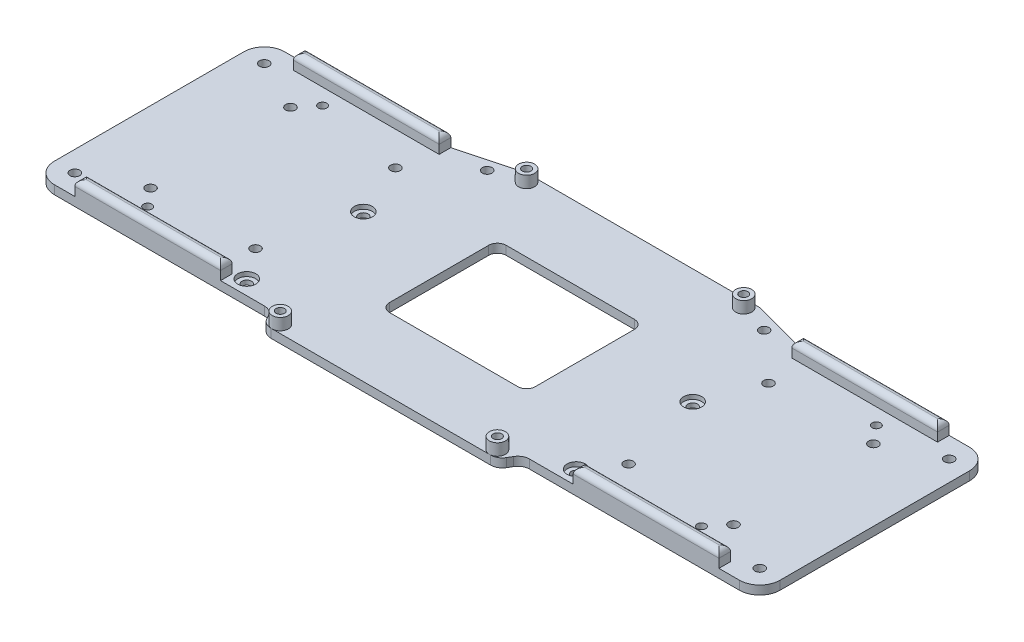
from build123d import *

# Parameters (mm, degrees)
SKETCH_1_R                                 = 1.65
EXTRUDE_1_DEPTH                            = 3
EXTRUDE_5_DEPTH                            = 3
SKETCH_3_R                                 = 2.75
EXTRUDE_3_DEPTH                            = 4
CUT_EXTRUDE_1_REACH                        = 134.568
SKETCH_4_R                                 = 1.45
CUT_EXTRUDE_2_REACH                        = 134.443
SKETCH_5_R                                 = 1.45
CUT_EXTRUDE_3_REACH                        = 134.443
SKETCH_6_R                                 = 1.65
CUT_EXTRUDE_4_REACH                        = 134.443
SKETCH_7_R                                 = 1.65
SKETCH_9_W                                 = 50
SKETCH_9_H                                 = 4
EXTRUDE_4_DEPTH                            = 5
MIRROR_4_AT_THE_SECOND_PLANE_COPY_1_SKET_W = 50
MIRROR_4_AT_THE_SECOND_PLANE_COPY_1_SKET_H = 4
MIRROR_4_AT_THE_SECOND_PLANE_COPY_1_DEPTH  = 5
FILLET_1_R                                 = 2
FILLET_2_R                                 = 4
CUT_EXTRUDE_6_REACH                        = 134.477
SKETCH_12_R                                = 3.1
CUT_EXTRUDE_7_DEPTH                        = 1.5
EXTRUDE_6_DEPTH                            = 3
FILLET_START                               = -1
FILLET_3_DEPTH                             = 5
FILLET_3_2_DEPTH                           = 3
CUT_EXTRUDE_8_REACH                        = 134.477
SKETCH_15_R                                = 1.65


with BuildPart() as part:
    # 草图1 → 凸台-拉伸1 (new body)
    with BuildSketch(Plane(origin=(0, 0, 0), x_dir=(1, 0, 0), z_dir=(0, 1, 0))):
        with BuildLine():
            Line((-124.5, 32.5), (-124.5, -32.5))
            ThreePointArc((-124.5, -32.5), (-122.449747468, -37.449747468), (-117.5, -39.5))
            Line((-117.5, -39.5), (117.5, -39.5))
            ThreePointArc((117.5, -39.5), (122.449747468, -37.449747468), (124.5, -32.5))
            Line((124.5, -32.5), (124.5, 32.5))
            ThreePointArc((124.5, 32.5), (122.449747468, 37.449747468), (117.5, 39.5))
            Line((117.5, 39.5), (-117.5, 39.5))
            ThreePointArc((-117.5, 39.5), (-122.449747468, 37.449747468), (-124.5, 32.5))
        make_face()
        with Locations(Location((-117.5, 32.5, 0), (0, 0, 270))):
            Circle(SKETCH_1_R, mode=Mode.SUBTRACT)
        with Locations(Location((-117.5, -32.5, 0), (0, 0, 270))):
            Circle(SKETCH_1_R, mode=Mode.SUBTRACT)
        with Locations(Location((117.5, 32.5, 0), (0, 0, 270))):
            Circle(SKETCH_1_R, mode=Mode.SUBTRACT)
        with Locations(Location((117.5, -32.5, 0), (0, 0, 270))):
            Circle(SKETCH_1_R, mode=Mode.SUBTRACT)
    extrude(amount=EXTRUDE_1_DEPTH)

    # 草图10 → 凸台-拉伸5 (add)
    with BuildSketch(Plane(origin=(0, 3, 0), x_dir=(1, 0, 0), z_dir=(0, 1, 0))):
        Polygon((-43.175426481, 39.5), (-40, 45), (40, 45), (43.175426481, 39.5), align=None)
        Polygon((-40, -45), (-43.175426481, -39.5), (43.175426481, -39.5), (40, -45), align=None)
    extrude(amount=-EXTRUDE_5_DEPTH)

    # 草图3 → 凸台-拉伸3 (add)
    with BuildSketch(Plane(origin=(0, 3, 0), x_dir=(1, 0, 0), z_dir=(0, 1, 0))):
        with Locations(Location((-37.25, 42.25, 0), (0, 0, 90))):
            Circle(SKETCH_3_R)
        with Locations(Location((37.25, 42.25, 0), (0, 0, 90))):
            Circle(SKETCH_3_R)
        with Locations(Location((-37.25, -42.25, 0), (0, 0, 270))):
            Circle(SKETCH_3_R)
        with Locations(Location((37.25, -42.25, 0), (0, 0, 270))):
            Circle(SKETCH_3_R)
    extrude(amount=EXTRUDE_3_DEPTH)

    # 草图4 → 切除-拉伸1 (cut, up to next)
    with BuildSketch(Plane(origin=(0, 7, 0), x_dir=(1, 0, 0), z_dir=(0, 1, 0)), mode=Mode.PRIVATE) as cut_extrude_1_sk1:
        with Locations(Location((-37.25, 42.25, 0), (0, 0, 270))):
            Circle(SKETCH_4_R)
    cut_extrude_1_tool1 = extrude(cut_extrude_1_sk1.sketch, amount=-CUT_EXTRUDE_1_REACH, mode=Mode.PRIVATE) & part.part
    # 草图4 → 切除-拉伸1 (cut, up to next)
    with BuildSketch(Plane(origin=(0, 7, 0), x_dir=(1, 0, 0), z_dir=(0, 1, 0)), mode=Mode.PRIVATE) as cut_extrude_1_sk2:
        with Locations(Location((37.25, 42.25, 0), (0, 0, 270))):
            Circle(SKETCH_4_R)
    cut_extrude_1_tool2 = extrude(cut_extrude_1_sk2.sketch, amount=-CUT_EXTRUDE_1_REACH, mode=Mode.PRIVATE) & part.part
    # 草图4 → 切除-拉伸1 (cut, up to next)
    with BuildSketch(Plane(origin=(0, 7, 0), x_dir=(1, 0, 0), z_dir=(0, 1, 0)), mode=Mode.PRIVATE) as cut_extrude_1_sk3:
        with Locations(Location((-37.25, -42.25, 0), (0, 0, 270))):
            Circle(SKETCH_4_R)
    cut_extrude_1_tool3 = extrude(cut_extrude_1_sk3.sketch, amount=-CUT_EXTRUDE_1_REACH, mode=Mode.PRIVATE) & part.part
    # 草图4 → 切除-拉伸1 (cut, up to next)
    with BuildSketch(Plane(origin=(0, 7, 0), x_dir=(1, 0, 0), z_dir=(0, 1, 0)), mode=Mode.PRIVATE) as cut_extrude_1_sk4:
        with Locations(Location((37.25, -42.25, 0), (0, 0, 270))):
            Circle(SKETCH_4_R)
    cut_extrude_1_tool4 = extrude(cut_extrude_1_sk4.sketch, amount=-CUT_EXTRUDE_1_REACH, mode=Mode.PRIVATE) & part.part
    add(cut_extrude_1_tool1.solids().sort_by_distance((-37.25, 7, -42.25))[0], mode=Mode.SUBTRACT)
    add(cut_extrude_1_tool2.solids().sort_by_distance((37.25, 7, -42.25))[0], mode=Mode.SUBTRACT)
    add(cut_extrude_1_tool3.solids().sort_by_distance((-37.25, 7, 42.25))[0], mode=Mode.SUBTRACT)
    add(cut_extrude_1_tool4.solids().sort_by_distance((37.25, 7, 42.25))[0], mode=Mode.SUBTRACT)

    # 草图5 → 切除-拉伸2 (cut, up to next)
    with BuildSketch(Plane(origin=(0, 3, 0), x_dir=(1, 0, 0), z_dir=(0, 1, 0)), mode=Mode.PRIVATE) as cut_extrude_2_sk1:
        with Locations(Location((-95, 30, 0), (0, 0, 270))):
            Circle(SKETCH_5_R)
    cut_extrude_2_tool1 = extrude(cut_extrude_2_sk1.sketch, amount=-CUT_EXTRUDE_2_REACH, mode=Mode.PRIVATE) & part.part
    # 草图5 → 切除-拉伸2 (cut, up to next)
    with BuildSketch(Plane(origin=(0, 3, 0), x_dir=(1, 0, 0), z_dir=(0, 1, 0)), mode=Mode.PRIVATE) as cut_extrude_2_sk2:
        with Locations(Location((-95, -30, 0), (0, 0, 270))):
            Circle(SKETCH_5_R)
    cut_extrude_2_tool2 = extrude(cut_extrude_2_sk2.sketch, amount=-CUT_EXTRUDE_2_REACH, mode=Mode.PRIVATE) & part.part
    # 草图5 → 切除-拉伸2 (cut, up to next)
    with BuildSketch(Plane(origin=(0, 3, 0), x_dir=(1, 0, 0), z_dir=(0, 1, 0)), mode=Mode.PRIVATE) as cut_extrude_2_sk3:
        with Locations(Location((95, 30, 0), (0, 0, 270))):
            Circle(SKETCH_5_R)
    cut_extrude_2_tool3 = extrude(cut_extrude_2_sk3.sketch, amount=-CUT_EXTRUDE_2_REACH, mode=Mode.PRIVATE) & part.part
    # 草图5 → 切除-拉伸2 (cut, up to next)
    with BuildSketch(Plane(origin=(0, 3, 0), x_dir=(1, 0, 0), z_dir=(0, 1, 0)), mode=Mode.PRIVATE) as cut_extrude_2_sk4:
        with Locations(Location((95, -30, 0), (0, 0, 270))):
            Circle(SKETCH_5_R)
    cut_extrude_2_tool4 = extrude(cut_extrude_2_sk4.sketch, amount=-CUT_EXTRUDE_2_REACH, mode=Mode.PRIVATE) & part.part
    add(cut_extrude_2_tool1.solids().sort_by_distance((-95, 3, -30))[0], mode=Mode.SUBTRACT)
    add(cut_extrude_2_tool2.solids().sort_by_distance((-95, 3, 30))[0], mode=Mode.SUBTRACT)
    add(cut_extrude_2_tool3.solids().sort_by_distance((95, 3, -30))[0], mode=Mode.SUBTRACT)
    add(cut_extrude_2_tool4.solids().sort_by_distance((95, 3, 30))[0], mode=Mode.SUBTRACT)

    # 草图6 → 切除-拉伸3 (cut, up to next)
    with BuildSketch(Plane(origin=(0, 3, 0), x_dir=(1, 0, 0), z_dir=(0, 1, 0)), mode=Mode.PRIVATE) as cut_extrude_3_sk1:
        with Locations(Location((-56.5, 5.5, 0), (0, 0, 270))):
            Circle(SKETCH_6_R)
    cut_extrude_3_tool1 = extrude(cut_extrude_3_sk1.sketch, amount=-CUT_EXTRUDE_3_REACH, mode=Mode.PRIVATE) & part.part
    # 草图6 → 切除-拉伸3 (cut, up to next)
    with BuildSketch(Plane(origin=(0, 3, 0), x_dir=(1, 0, 0), z_dir=(0, 1, 0)), mode=Mode.PRIVATE) as cut_extrude_3_sk2:
        with Locations(Location((-56.5, -34.5, 0), (0, 0, 270))):
            Circle(SKETCH_6_R)
    cut_extrude_3_tool2 = extrude(cut_extrude_3_sk2.sketch, amount=-CUT_EXTRUDE_3_REACH, mode=Mode.PRIVATE) & part.part
    cut_extrude_3_1 = cut_extrude_3_tool1.solids().sort_by_distance((-56.5, 3, -5.5))[0]
    add(cut_extrude_3_1, mode=Mode.SUBTRACT)
    cut_extrude_3_2 = cut_extrude_3_tool2.solids().sort_by_distance((-56.5, 3, 34.5))[0]
    add(cut_extrude_3_2, mode=Mode.SUBTRACT)
    cut_extrude_3 = cut_extrude_3_1 + cut_extrude_3_2  # 切除-拉伸3 as one shape, for the pattern or mirror that repeats it

    # 草图7 → 切除-拉伸4 (cut, up to next)
    with BuildSketch(Plane(origin=(0, 3, 0), x_dir=(1, 0, 0), z_dir=(0, 1, 0)), mode=Mode.PRIVATE) as cut_extrude_4_sk1:
        with Locations(Location((-100, 24, 0), (0, 0, 270))):
            Circle(SKETCH_7_R)
    cut_extrude_4_tool1 = extrude(cut_extrude_4_sk1.sketch, amount=-CUT_EXTRUDE_4_REACH, mode=Mode.PRIVATE) & part.part
    # 草图7 → 切除-拉伸4 (cut, up to next)
    with BuildSketch(Plane(origin=(0, 3, 0), x_dir=(1, 0, 0), z_dir=(0, 1, 0)), mode=Mode.PRIVATE) as cut_extrude_4_sk2:
        with Locations(Location((-64, 24, 0), (0, 0, 270))):
            Circle(SKETCH_7_R)
    cut_extrude_4_tool2 = extrude(cut_extrude_4_sk2.sketch, amount=-CUT_EXTRUDE_4_REACH, mode=Mode.PRIVATE) & part.part
    # 草图7 → 切除-拉伸4 (cut, up to next)
    with BuildSketch(Plane(origin=(0, 3, 0), x_dir=(1, 0, 0), z_dir=(0, 1, 0)), mode=Mode.PRIVATE) as cut_extrude_4_sk3:
        with Locations(Location((-100, -24, 0), (0, 0, 270))):
            Circle(SKETCH_7_R)
    cut_extrude_4_tool3 = extrude(cut_extrude_4_sk3.sketch, amount=-CUT_EXTRUDE_4_REACH, mode=Mode.PRIVATE) & part.part
    # 草图7 → 切除-拉伸4 (cut, up to next)
    with BuildSketch(Plane(origin=(0, 3, 0), x_dir=(1, 0, 0), z_dir=(0, 1, 0)), mode=Mode.PRIVATE) as cut_extrude_4_sk4:
        with Locations(Location((-64, -24, 0), (0, 0, 270))):
            Circle(SKETCH_7_R)
    cut_extrude_4_tool4 = extrude(cut_extrude_4_sk4.sketch, amount=-CUT_EXTRUDE_4_REACH, mode=Mode.PRIVATE) & part.part
    cut_extrude_4_1 = cut_extrude_4_tool1.solids().sort_by_distance((-100, 3, -24))[0]
    add(cut_extrude_4_1, mode=Mode.SUBTRACT)
    cut_extrude_4_2 = cut_extrude_4_tool2.solids().sort_by_distance((-64, 3, -24))[0]
    add(cut_extrude_4_2, mode=Mode.SUBTRACT)
    cut_extrude_4_3 = cut_extrude_4_tool3.solids().sort_by_distance((-100, 3, 24))[0]
    add(cut_extrude_4_3, mode=Mode.SUBTRACT)
    cut_extrude_4_4 = cut_extrude_4_tool4.solids().sort_by_distance((-64, 3, 24))[0]
    add(cut_extrude_4_4, mode=Mode.SUBTRACT)
    cut_extrude_4 = cut_extrude_4_1 + cut_extrude_4_2 + cut_extrude_4_3 + cut_extrude_4_4  # 切除-拉伸4 as one shape, for the pattern or mirror that repeats it

    # 草图9 → 凸台-拉伸4 (add)
    with BuildSketch(Plane(origin=(0, 3, 0), x_dir=(1, 0, 0), z_dir=(0, 1, 0))):
        with Locations((-85.5, -37.5)):
            Rectangle(SKETCH_9_W, SKETCH_9_H)
    extrude_4 = extrude(amount=EXTRUDE_4_DEPTH)

    # 镜向1: 切除-拉伸3, 切除-拉伸4 across plane
    add(cut_extrude_3.mirror(Plane(origin=(0, 0, 0), x_dir=(0, 0, 1), z_dir=(1, 0, 0))), mode=Mode.SUBTRACT)
    add(cut_extrude_4.mirror(Plane(origin=(0, 0, 0), x_dir=(0, 0, 1), z_dir=(1, 0, 0))), mode=Mode.SUBTRACT)

    # 镜向4: 凸台-拉伸4 across plane
    add(extrude_4.mirror(Plane(origin=(0, 0, 0), x_dir=(0, 0, 1), z_dir=(1, 0, 0))))

    # 镜向4 at the second plane: 凸台-拉伸4 across plane
    add(extrude_4.mirror(Plane.XY))

    # 镜向4 at the second plane copy 1 sket → 镜向4 at the second plane copy 1 (add)
    with BuildSketch(Plane(origin=(0, 3, 0), x_dir=(-1, 0, 0), z_dir=(0, 1, 0))):
        with Locations((-85.5, -37.5)):
            Rectangle(MIRROR_4_AT_THE_SECOND_PLANE_COPY_1_SKET_W, MIRROR_4_AT_THE_SECOND_PLANE_COPY_1_SKET_H)
    extrude(amount=MIRROR_4_AT_THE_SECOND_PLANE_COPY_1_DEPTH)

    # 圆角1
    fillet_1_edges = [part.edges().sort_by_distance(p)[0] for p in [
        (-110.5, 8, 37.5),
        (-85.5, 8, 39.5),
        (-60.5, 8, 37.5),
        (-85.5, 8, 35.5),
        (-110.5, 8, -37.5),
        (-85.5, 8, -35.5),
        (-60.5, 8, -37.5),
        (-85.5, 8, -39.5),
        (110.5, 8, 37.5),
        (85.5, 8, 35.5),
        (60.5, 8, 37.5),
        (85.5, 8, 39.5),
        (110.5, 8, -37.5),
        (85.5, 8, -39.5),
        (60.5, 8, -37.5),
        (85.5, 8, -35.5),
    ]]
    fillet(fillet_1_edges, radius=FILLET_1_R - 0.0001)  # a hair under: the kernel refuses the full size

    # 圆角2
    fillet_2_edges = [part.edges().sort_by_distance(p)[0] for p in [
        (40, 1.5, 45),
        (-40, 1.5, 45),
        (-43.175426481, 1.5, 39.5),
        (43.175426481, 1.5, 39.5),
    ]]
    fillet(fillet_2_edges, radius=FILLET_2_R)

    # 草图11 → 切除-拉伸6 (cut, up to next)
    with BuildSketch(Plane(origin=(0, 3, 0), x_dir=(1, 0, 0), z_dir=(0, 1, 0)), mode=Mode.PRIVATE) as cut_extrude_6_sk1:
        with BuildLine():
            Line((-22, -20), (22, -20))
            ThreePointArc((22, -20), (24.121320344, -19.121320344), (25, -17))
            Line((25, -17), (25, 17))
            ThreePointArc((25, 17), (24.121320344, 19.121320344), (22, 20))
            Line((22, 20), (-22, 20))
            ThreePointArc((-22, 20), (-24.121320344, 19.121320344), (-25, 17))
            Line((-25, 17), (-25, -17))
            ThreePointArc((-25, -17), (-24.121320344, -19.121320344), (-22, -20))
        make_face()
    cut_extrude_6_tool1 = extrude(cut_extrude_6_sk1.sketch, amount=-CUT_EXTRUDE_6_REACH, mode=Mode.PRIVATE) & part.part
    add(cut_extrude_6_tool1.solids().sort_by_distance((0, 3, 0))[0], mode=Mode.SUBTRACT)

    # 草图12 → 切除-拉伸7 (cut)
    with BuildSketch(Plane(origin=(0, 3, 0), x_dir=(1, 0, 0), z_dir=(0, 1, 0))):
        with Locations(Location((-56.5, 5.5, 0), (0, 0, 270))):
            Circle(SKETCH_12_R)
        with Locations(Location((-56.5, -34.5, 0), (0, 0, 270))):
            Circle(SKETCH_12_R)
        with Locations(Location((56.5, 5.5, 0), (0, 0, 270))):
            Circle(SKETCH_12_R)
        with Locations(Location((56.5, -34.5, 0), (0, 0, 270))):
            Circle(SKETCH_12_R)
    extrude(amount=-CUT_EXTRUDE_7_DEPTH, mode=Mode.SUBTRACT)

    # 草图14 → 凸台-拉伸6 (add)
    with BuildSketch(Plane(origin=(0, 3, 0), x_dir=(1, 0, 0), z_dir=(0, 1, 0))):
        Polygon((-60.5, 39.5), (-40, 45), (-43.175426481, 39.5), align=None)
        Polygon((40, 45), (60.5, 39.5), (43.175426481, 39.5), align=None)
    extrude(amount=-EXTRUDE_6_DEPTH)

    # 圆角3: read off the stored shape, not the designer's step
    # 圆角3 outline → 圆角3 (cut)
    with BuildSketch(Plane(origin=(0, 0, 0), x_dir=(1, 0, 0), z_dir=(0, 1, 0)).offset(FILLET_START)):
        with BuildLine():
            ThreePointArc((-40.636565306, 44.829214186), (-39.994347708, 44.957119674), (-39.340922476, 45))
            Line((-39.340922476, 45), (-40, 45))
            Line((-40, 45), (-40.636565306, 44.829214186))
        make_face()
        with BuildLine():
            ThreePointArc((39.340922476, 45), (39.994347708, 44.957119674), (40.636565306, 44.829214186))
            Line((40.636565306, 44.829214186), (40, 45))
            Line((40, 45), (39.340922476, 45))
        make_face()
    extrude(amount=FILLET_3_DEPTH, mode=Mode.SUBTRACT)

    # Fillet 3 2 outline → Fillet 3 2 (add)
    with BuildSketch(Plane(origin=(0, 0, 0), x_dir=(1, 0, 0), z_dir=(0, 1, 0))):
        with BuildLine():
            Line((-60.5, 39.5), (-59.863434694, 39.670785814))
            ThreePointArc((-59.863434694, 39.670785814), (-60.505652292, 39.542880326), (-61.159077524, 39.5))
            Line((-61.159077524, 39.5), (-60.5, 39.5))
        make_face()
        with BuildLine():
            ThreePointArc((61.159077524, 39.5), (60.505652292, 39.542880326), (59.863434694, 39.670785814))
            Line((59.863434694, 39.670785814), (60.5, 39.5))
            Line((60.5, 39.5), (61.159077524, 39.5))
        make_face()
    extrude(amount=FILLET_3_2_DEPTH)

    # 草图15 → 切除-拉伸8 (cut, up to next)
    with BuildSketch(Plane(origin=(0, 3, 0), x_dir=(1, 0, 0), z_dir=(0, 1, 0)), mode=Mode.PRIVATE) as cut_extrude_8_sk1:
        with Locations(Location((-47.5, 39, 0), (0, 0, 270))):
            Circle(SKETCH_15_R)
    cut_extrude_8_tool1 = extrude(cut_extrude_8_sk1.sketch, amount=-CUT_EXTRUDE_8_REACH, mode=Mode.PRIVATE) & part.part
    # 草图15 → 切除-拉伸8 (cut, up to next)
    with BuildSketch(Plane(origin=(0, 3, 0), x_dir=(1, 0, 0), z_dir=(0, 1, 0)), mode=Mode.PRIVATE) as cut_extrude_8_sk2:
        with Locations(Location((47.5, 39, 0), (0, 0, 270))):
            Circle(SKETCH_15_R)
    cut_extrude_8_tool2 = extrude(cut_extrude_8_sk2.sketch, amount=-CUT_EXTRUDE_8_REACH, mode=Mode.PRIVATE) & part.part
    add(cut_extrude_8_tool1.solids().sort_by_distance((-47.5, 3, -39))[0], mode=Mode.SUBTRACT)
    add(cut_extrude_8_tool2.solids().sort_by_distance((47.5, 3, -39))[0], mode=Mode.SUBTRACT)


solid = part.part
